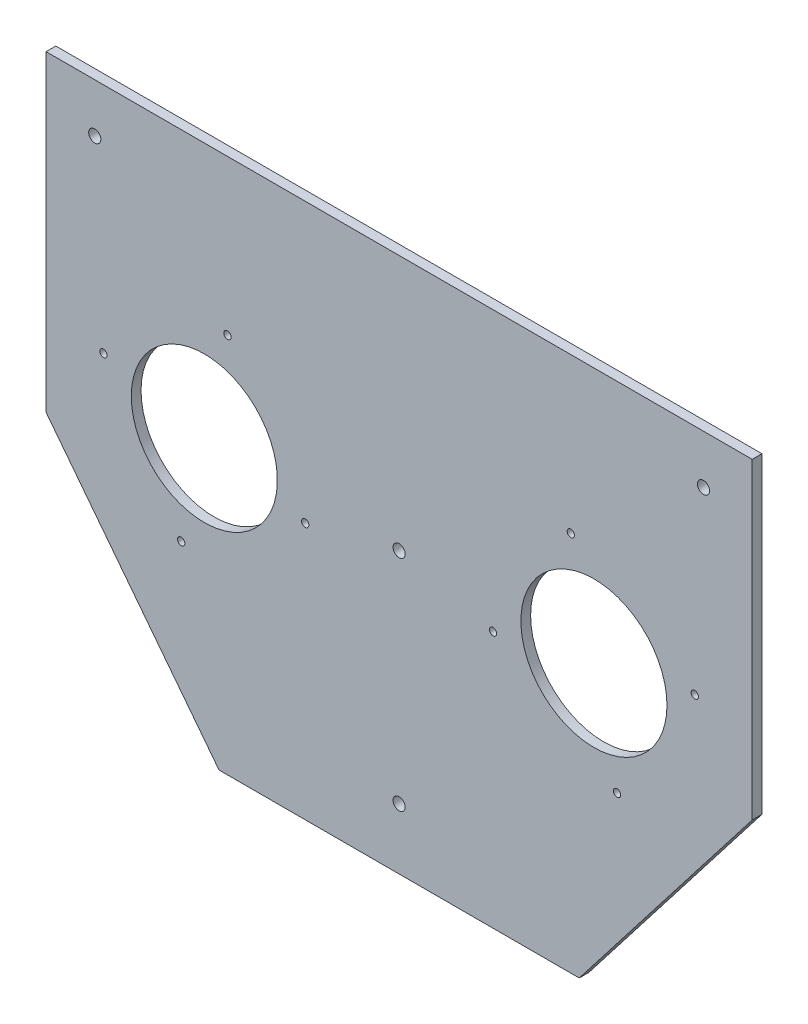
from build123d import *

# Parameters (mm, degrees)
SKETCH1_R           = 2.5
BOSS_EXTRUDE1_DEPTH = 4
SKETCH2_R           = 1.5
SKETCH2_R_2         = 30
SKETCH2_R_3         = 2.5
CUT_EXTRUDE1_DEPTH  = 10


with BuildPart() as part:
    # Sketch1 → Boss-Extrude1 (new body)
    with BuildSketch(Plane.XY):
        Polygon((-145, -8.284271247), (-73.964667719, -100), (73.964667719, -100), (145, -8.284271247), (145, 120), (-145, 120), align=None)
        with Locations((-125, 100)):
            Circle(SKETCH1_R, mode=Mode.SUBTRACT)
        with Locations((125, 100)):
            Circle(SKETCH1_R, mode=Mode.SUBTRACT)
        with Locations((0, -75)):
            Circle(SKETCH1_R, mode=Mode.SUBTRACT)
    extrude(amount=BOSS_EXTRUDE1_DEPTH)

    # Sketch2 → Cut-Extrude1 (cut)
    with BuildSketch(Plane.XY.offset(4)):
        with Locations((38.573620895, 5.507628631)):
            Circle(SKETCH2_R)
        with Locations((70.507628631, 56.426379105)):
            Circle(SKETCH2_R)
        with Locations((121.426379105, 24.492371369)):
            Circle(SKETCH2_R)
        with Locations((89.492371369, -26.426379105)):
            Circle(SKETCH2_R)
        with Locations((80, 15)):
            Circle(SKETCH2_R_2)
        with Locations((-38.573620895, 5.507628631)):
            Circle(SKETCH2_R)
        with Locations((-70.507628631, 56.426379105)):
            Circle(SKETCH2_R)
        with Locations((-89.492371369, -26.426379105)):
            Circle(SKETCH2_R)
        with Locations((-121.426379105, 24.492371369)):
            Circle(SKETCH2_R)
        with Locations((-80, 15)):
            Circle(SKETCH2_R_2)
        with Locations((0, 15)):
            Circle(SKETCH2_R_3)
    extrude(amount=-CUT_EXTRUDE1_DEPTH, mode=Mode.SUBTRACT)


solid = part.part
